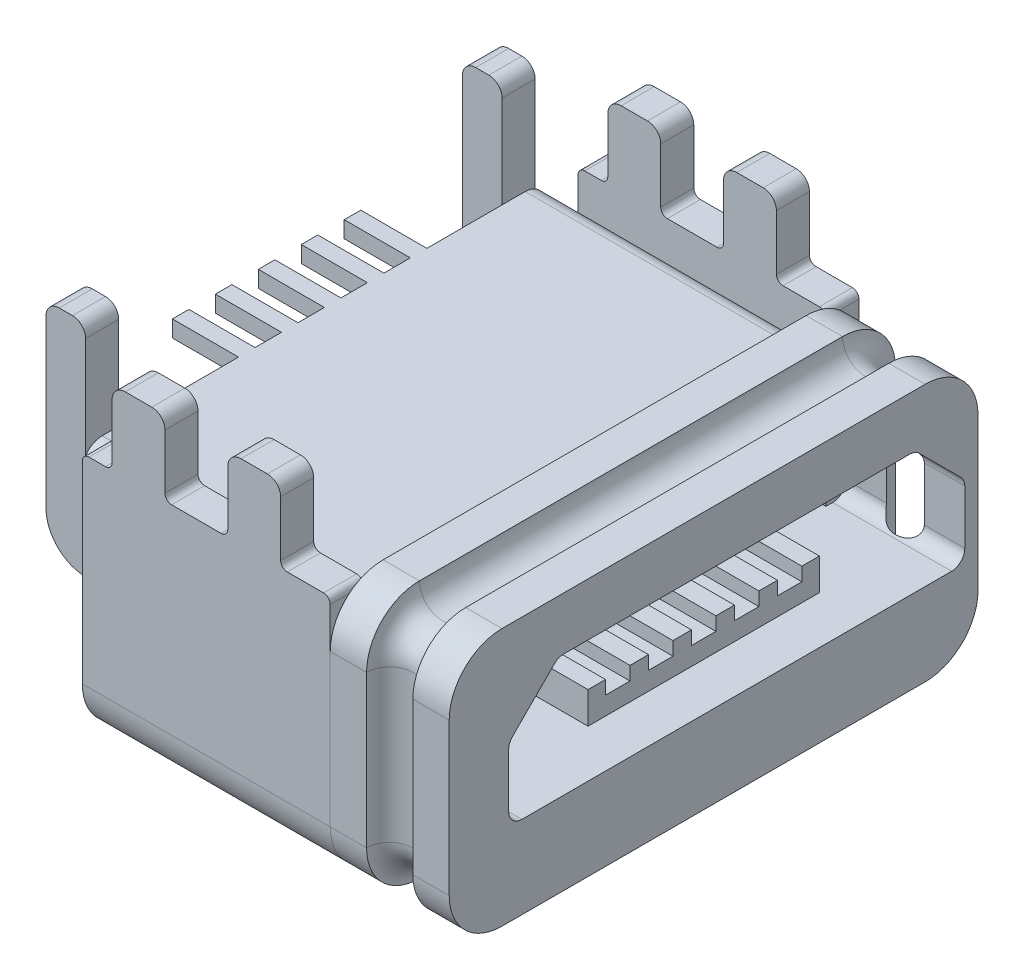
from build123d import *

# Parameters (mm, degrees)
BOSS_EXTRUDE1_DEPTH      = 6.05
CUT_EXTRUDE1_START       = -4.25
CUT_EXTRUDE1_DEPTH       = 4.25
SKETCH4_R                = 0.35
BOSS_EXTRUDE2_DEPTH      = 3.75
SURFACECUT1_START        = -0.079067832
SURFACECUT1_OUTLINE_W    = 0.45
SURFACECUT1_OUTLINE_H    = 0.5
SURFACECUT1_OUTLINE_W_2  = 0.95
SURFACECUT1_OUTLINE_W_3  = 0.75
SURFACECUT1_DEPTH        = 1.129067832
SURFACECUT1_START_2      = -0.083880527
SURFACECUT1_2_OUTLINE_W  = 0.75
SURFACECUT1_2_OUTLINE_H  = 0.5
SURFACECUT1_2_DEPTH      = 0.004812695
FILLET1_R                = 0.1
FILLET2_R                = 0.2
BOSS_EXTRUDE3_DEPTH      = 0.25
BOSS_EXTRUDE3_DEPTH_BACK = 0.25
SKETCH8_W                = 1
SKETCH8_H                = 0.25
BOSS_EXTRUDE4_DEPTH      = 0.25
CUT_EXTRUDE2_DEPTH       = 3.5
FILLET3_R                = 0.2
BOSS_EXTRUDE5_DEPTH      = 3
SKETCH11_W               = 1
SKETCH11_H               = 1.615622931
CUT_EXTRUDE3_DEPTH       = 23.009657067
SKETCH11_2_W             = 1
SKETCH11_2_H             = 1.615622931
BOSS_EXTRUDE6_DEPTH      = 1.469739


# Read off the part's stored shape, not the designer's step: SurfaceCut1
with BuildPart() as part:
    # Sketch1 → Boss-Extrude1 (new body)
    with BuildSketch(Plane(origin=(21, 0, 0), x_dir=(0, 0, -1), z_dir=(1, 0, 0))):
        with BuildLine():
            Line((-3.55, -3.9), (2.85, -3.9))
            ThreePointArc((2.85, -3.9), (3.415685425, -3.665685425), (3.65, -3.1))
            Line((3.65, -3.1), (3.65, -0.8))
            ThreePointArc((3.65, -0.8), (3.415685425, -0.234314575), (2.85, 0))
            Line((2.85, 0), (-3.55, 0))
            ThreePointArc((-3.55, 0), (-4.115685425, -0.234314575), (-4.35, -0.8))
            Line((-4.35, -0.8), (-4.35, -3.1))
            ThreePointArc((-4.35, -3.1), (-4.115685425, -3.665685425), (-3.55, -3.9))
        make_face()
    extrude(amount=-BOSS_EXTRUDE1_DEPTH)

    # Sketch2 → Cut-Extrude1 (cut)
    with BuildSketch(Plane.ZY.offset(-14.95).offset(CUT_EXTRUDE1_START)):
        with BuildLine():
            Line((4.35, -3.1), (4.35, -0.8))
            ThreePointArc((4.35, -0.8), (4.115685425, -0.234314575), (3.55, 0))
            Line((3.55, 0), (-2.85, 0))
            ThreePointArc((-2.85, 0), (-3.415685425, -0.234314575), (-3.65, -0.8))
            Line((-3.65, -0.8), (-3.65, -3.1))
            ThreePointArc((-3.65, -3.1), (-3.415685425, -3.665685425), (-2.85, -3.9))
            Line((-2.85, -3.9), (3.55, -3.9))
            ThreePointArc((3.55, -3.9), (4.115685425, -3.665685425), (4.35, -3.1))
        make_face()
        with BuildLine():
            Line((3.55, -0.5), (-2.85, -0.5))
            ThreePointArc((-2.85, -0.5), (-3.062132034, -0.587867966), (-3.15, -0.8))
            Line((-3.15, -0.8), (-3.15, -3.1))
            ThreePointArc((-3.15, -3.1), (-3.062132034, -3.312132034), (-2.85, -3.4))
            Line((-2.85, -3.4), (3.55, -3.4))
            ThreePointArc((3.55, -3.4), (3.762132034, -3.312132034), (3.85, -3.1))
            Line((3.85, -3.1), (3.85, -0.8))
            ThreePointArc((3.85, -0.8), (3.762132034, -0.587867966), (3.55, -0.5))
        make_face(mode=Mode.SUBTRACT)
    extrude(amount=CUT_EXTRUDE1_DEPTH, mode=Mode.SUBTRACT)

    # Cut-Sweep1: sweep along a path in Sketch3
    with BuildLine(Plane(origin=(20.1, 0, 0), x_dir=(0, 0, -1), z_dir=(1, 0, 0))) as cut_sweep1_path:
        Line((-3.55, -3.9), (2.85, -3.9))
        ThreePointArc((2.85, -3.9), (3.415685425, -3.665685425), (3.65, -3.1))
        Line((3.65, -3.1), (3.65, -0.8))
        ThreePointArc((3.65, -0.8), (3.415685425, -0.234314575), (2.85, 0))
        Line((2.85, 0), (-3.55, 0))
        ThreePointArc((-3.55, 0), (-4.115685425, -0.234314575), (-4.35, -0.8))
        Line((-4.35, -0.8), (-4.35, -3.1))
        ThreePointArc((-4.35, -3.1), (-4.115685425, -3.665685425), (-3.55, -3.9))
    # Sketch4 → Cut-Sweep1 (sweep, cut)
    with BuildSketch(Plane.XY):
        with Locations((20.1, 0)):
            Circle(SKETCH4_R)
    sweep(path=cut_sweep1_path.line, mode=Mode.SUBTRACT)

    # Sketch8 → Boss-Extrude4 (add)
    with BuildSketch(Plane(origin=(0, -0.5, 0), x_dir=(1, 0, 0), z_dir=(0, 1, 0))):
        with Locations((14.45, -0.062906509)):
            Rectangle(SKETCH8_W, SKETCH8_H)
        with Locations((14.45, 0.587093491)):
            Rectangle(SKETCH8_W, SKETCH8_H)
        with Locations((14.45, 1.237093491)):
            Rectangle(SKETCH8_W, SKETCH8_H)
        with Locations((14.45, -0.712906509)):
            Rectangle(SKETCH8_W, SKETCH8_H)
        with Locations((14.45, -1.362906509)):
            Rectangle(SKETCH8_W, SKETCH8_H)
    extrude(amount=-BOSS_EXTRUDE4_DEPTH)

    # Sketch9 → Cut-Extrude2 (cut)
    with BuildSketch(Plane(origin=(21, 0, 0), x_dir=(0, 0, -1), z_dir=(1, 0, 0))):
        Polygon((-3.45, -2.650260781), (3.45, -2.650260781), (3.45, -1.550260781), (2.7, -0.800260781), (-2.7, -0.800260781), (-3.45, -1.550260781), align=None)
    extrude(amount=-CUT_EXTRUDE2_DEPTH, mode=Mode.SUBTRACT)

    # Fillet3
    fillet3_edges = [part.edges().sort_by_distance(p)[0] for p in [
        (19.25, -2.650260781, 3.45),
        (19.25, -1.550260781, 3.45),
        (19.25, -0.800260781, 2.7),
        (19.25, -0.800260781, -2.7),
        (20.693614066, -1.550260781, -3.45),
        (20.693614066, -2.650260781, -3.45),
    ]]
    fillet(fillet3_edges, radius=FILLET3_R - 0.0001)  # a hair under: the kernel refuses the full size

    # Sketch11<2> → Boss-Extrude6 (add)
    with BuildSketch(Plane.XZ.offset(3.9)):
        with Locations((18.7, 0.062906509)):
            Rectangle(SKETCH11_2_W, SKETCH11_2_H)
    extrude(amount=-BOSS_EXTRUDE6_DEPTH)


with BuildPart() as body_2:
    # Sketch5 → Boss-Extrude2 (new body)
    with BuildSketch(Plane.ZY.offset(-19.2)):
        with BuildLine():
            Line((-3.15, -0.8), (-3.15, 1.05))
            Line((-3.15, 1.05), (-3.65, 1.05))
            Line((-3.65, 1.05), (-3.65, -0.8))
            Line((-3.65, -0.8), (-3.65, -3.1))
            ThreePointArc((-3.65, -3.1), (-3.415685425, -3.665685425), (-2.85, -3.9))
            Line((-2.85, -3.9), (3.55, -3.9))
            ThreePointArc((3.55, -3.9), (4.115685425, -3.665685425), (4.35, -3.1))
            Line((4.35, -3.1), (4.35, -0.8))
            Line((4.35, -0.8), (4.35, 1.05))
            Line((4.35, 1.05), (3.85, 1.05))
            Line((3.85, 1.05), (3.85, -0.8))
            Line((3.85, -0.8), (3.85, -3.1))
            ThreePointArc((3.85, -3.1), (3.762132034, -3.312132034), (3.55, -3.4))
            Line((3.55, -3.4), (-2.85, -3.4))
            ThreePointArc((-2.85, -3.4), (-3.062132034, -3.312132034), (-3.15, -3.1))
            Line((-3.15, -3.1), (-3.15, -0.8))
        make_face()
    extrude(amount=BOSS_EXTRUDE2_DEPTH)

    # SurfaceCut1 outline → SurfaceCut1 (cut)
    with BuildSketch(Plane(origin=(0, 0, 0), x_dir=(1, 0, 0), z_dir=(0, 1, 0)).offset(SURFACECUT1_START)):
        with Locations((15.675, -4.1)):
            Rectangle(SURFACECUT1_OUTLINE_W, SURFACECUT1_OUTLINE_H)
        with Locations((17.175, -4.1)):
            Rectangle(SURFACECUT1_OUTLINE_W_2, SURFACECUT1_OUTLINE_H)
        with Locations((15.675, 3.4)):
            Rectangle(SURFACECUT1_OUTLINE_W, SURFACECUT1_OUTLINE_H)
        with Locations((18.825, -4.1)):
            Rectangle(SURFACECUT1_OUTLINE_W_3, SURFACECUT1_OUTLINE_H)
        with Locations((17.175, 3.4)):
            Rectangle(SURFACECUT1_OUTLINE_W_2, SURFACECUT1_OUTLINE_H)
        with Locations((18.825, 3.4)):
            Rectangle(SURFACECUT1_OUTLINE_W_3, SURFACECUT1_OUTLINE_H)
    extrude(amount=SURFACECUT1_DEPTH, mode=Mode.SUBTRACT)

    # SurfaceCut1 2 outline → SurfaceCut1 2 (cut)
    with BuildSketch(Plane(origin=(0, 0, 0), x_dir=(1, 0, 0), z_dir=(0, 1, 0)).offset(SURFACECUT1_START_2)):
        with Locations((18.825, -4.1)):
            Rectangle(SURFACECUT1_2_OUTLINE_W, SURFACECUT1_2_OUTLINE_H)
        with Locations((18.825, 3.4)):
            Rectangle(SURFACECUT1_2_OUTLINE_W, SURFACECUT1_2_OUTLINE_H)
    extrude(amount=SURFACECUT1_2_DEPTH, mode=Mode.SUBTRACT)

    # Fillet1
    fillet1_edges = [body_2.edges().sort_by_distance(p)[0] for p in [
        (15.45, -0.079067832, 4.1),
        (15.45, -0.079067832, -3.4),
        (18.45, -0.083880527, -3.4),
        (18.45, -0.083880527, 4.1),
        (17.65, -0.079067832, -3.4),
        (17.65, -0.079067832, 4.1),
        (16.7, -0.079067832, -3.4),
        (16.7, -0.079067832, 4.1),
        (15.9, -0.079067832, -3.4),
        (15.9, -0.079067832, 4.1),
        (19.2, -0.083880527, -3.4),
        (19.2, -0.083880527, 4.1),
    ]]
    fillet(fillet1_edges, radius=FILLET1_R)

    # Fillet2
    fillet2_edges = [body_2.edges().sort_by_distance(p)[0] for p in [
        (18.45, 1.05, -3.4),
        (18.45, 1.05, 4.1),
        (17.65, 1.05, -3.4),
        (17.65, 1.05, 4.1),
        (16.7, 1.05, -3.4),
        (16.7, 1.05, 4.1),
        (15.9, 1.05, -3.4),
        (15.9, 1.05, 4.1),
    ]]
    fillet(fillet2_edges, radius=FILLET2_R)

    # Sketch11 → Cut-Extrude3 (cut, through all)
    with BuildSketch(Plane.XZ.offset(3.9)):
        with Locations((18.7, 0.062906509)):
            Rectangle(SKETCH11_W, SKETCH11_H)
    extrude(amount=-CUT_EXTRUDE3_DEPTH, mode=Mode.SUBTRACT)


with BuildPart() as body_3:
    # Sketch7 → Boss-Extrude3 (new, two sides: drawn at the far end of the back side and taken through both)
    with BuildSketch(Plane.XY.offset(3.5).offset(-BOSS_EXTRUDE3_DEPTH_BACK)):
        with BuildLine():
            Line((14.7, 1.05), (14.5, 1.05))
            ThreePointArc((14.5, 1.05), (14.358578644, 0.991421356), (14.3, 0.85))
            Line((14.3, 0.85), (14.3, -1.672412117))
            ThreePointArc((14.3, -1.672412117), (14.475735931, -2.096676185), (14.9, -2.272412117))
            Line((14.9, -2.272412117), (14.95, -2.272412117))
            Line((14.95, -2.272412117), (14.95, -1.672412117))
            Line((14.95, -1.672412117), (14.9, -1.672412117))
            Line((14.9, -1.672412117), (14.9, 0.85))
            ThreePointArc((14.9, 0.85), (14.841421356, 0.991421356), (14.7, 1.05))
        make_face()
    extrude(amount=BOSS_EXTRUDE3_DEPTH + BOSS_EXTRUDE3_DEPTH_BACK)


with BuildPart() as body_4:
    # Mirror1: mirrored copy
    add(body_3.part.mirror(Plane.XY.offset(0.35)))


with BuildPart() as body_5:
    # Sketch10 → Boss-Extrude5 (new body)
    with BuildSketch(Plane(origin=(17.5, 0, 0), x_dir=(0, 0, -1), z_dir=(1, 0, 0))):
        Polygon((-1.75, -1.950260781), (-1.485, -1.950260781), (-1.485, -2.155321077), (-1.115, -2.155321077), (-1.115, -1.950260781), (-0.835, -1.950260781), (-0.835, -2.155321077), (-0.465, -2.155321077), (-0.465, -1.950260781), (-0.185, -1.950260781), (-0.185, -2.155321077), (0.185, -2.155321077), (0.185, -1.950260781), (0.465, -1.950260781), (0.465, -2.155321077), (0.835, -2.155321077), (0.835, -1.950260781), (1.115, -1.950260781), (1.115, -2.155321077), (1.485, -2.155321077), (1.485, -1.950260781), (1.75, -1.950260781), (1.75, -2.430260781), (-1.75, -2.430260781), align=None)
    extrude(amount=BOSS_EXTRUDE5_DEPTH)


solid = Compound([part.part, body_2.part, body_3.part, body_4.part, body_5.part])
